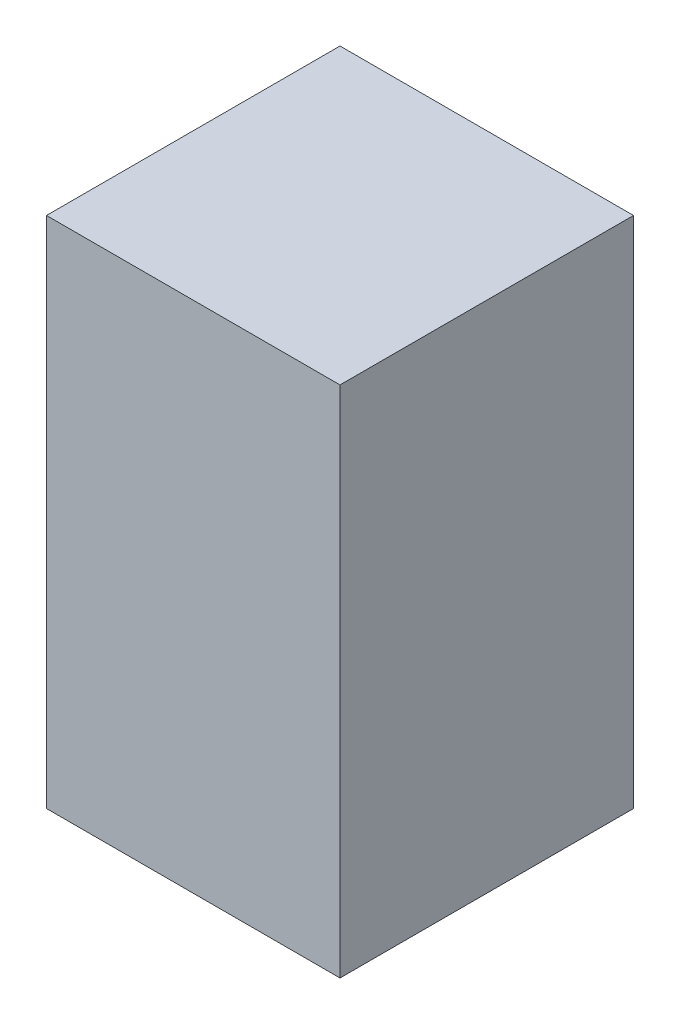
from build123d import *

# Parameters (mm, degrees)
SKETCH1_W                                     = 1219.2
SKETCH1_H                                     = 1219.2
ILLUMINANCE_PLANE_2_27_2019_10_35_29_AM_DEPTH = 2133.6


with BuildPart() as part:
    # Sketch1 → Illuminance Plane 2-27-2019 10_35_29 AM (new body)
    with BuildSketch(Plane(origin=(0, 0, 0), x_dir=(1, 0, 0), z_dir=(0, 1, 0))):
        Rectangle(SKETCH1_W, SKETCH1_H)
    extrude(amount=ILLUMINANCE_PLANE_2_27_2019_10_35_29_AM_DEPTH)


solid = part.part
